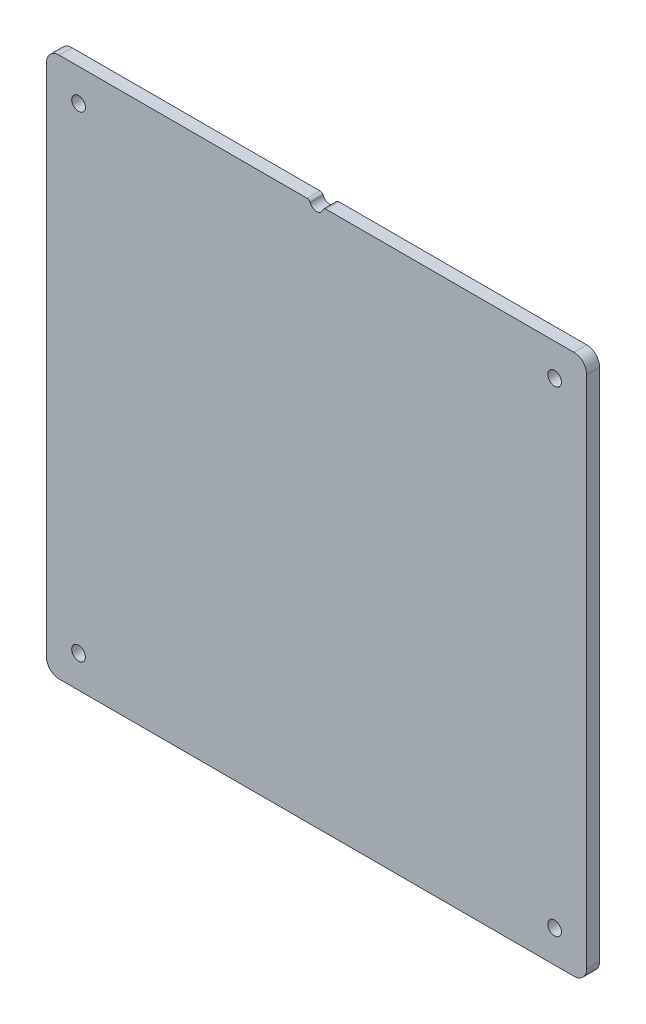
from build123d import *

# Parameters (mm, degrees)
SKETCH1_W               = 266.7
SKETCH1_H               = 266.7
BOSS_EXTRUDE1_DEPTH     = 6.35
F_1_4_CLEARANCE_HOLE1_D = 6.7564
FILLET1_R               = 6.35
SKETCH4_R               = 3.302
CUT_EXTRUDE1_DEPTH      = 189.692256068
FILLET2_R               = 1.5875


with BuildPart() as part:
    # Sketch1 → Boss-Extrude1 (new body)
    with BuildSketch(Plane.XY):
        Rectangle(SKETCH1_W, SKETCH1_H)
    extrude(amount=BOSS_EXTRUDE1_DEPTH)

    # 1/4 Clearance Hole1 (through all)
    with Locations(Plane.XY.offset(6.35)):
        with Locations((-117.475, 117.475), (-117.475, -117.475), (117.475, -117.475), (117.475, 117.475)):
            Hole(F_1_4_CLEARANCE_HOLE1_D / 2)

    # Fillet1
    fillet1_edges = [part.edges().sort_by_distance(p)[0] for p in [
        (133.35, -133.35, 3.175),
        (-133.35, -133.35, 3.175),
        (133.35, 133.35, 3.175),
        (-133.35, 133.35, 3.175),
    ]]
    fillet(fillet1_edges, radius=FILLET1_R)

    # Sketch4 → Cut-Extrude1 (cut, through all)
    with BuildSketch(Plane.XY.offset(6.35)):
        with Locations((0, 133.35)):
            Circle(SKETCH4_R)
    extrude(amount=-CUT_EXTRUDE1_DEPTH, mode=Mode.SUBTRACT)

    # Fillet2
    fillet2_edges = [part.edges().sort_by_distance(p)[0] for p in [
        (3.302, 133.35, 3.175),
        (-3.302, 133.35, 3.175),
    ]]
    fillet(fillet2_edges, radius=FILLET2_R)


solid = part.part
